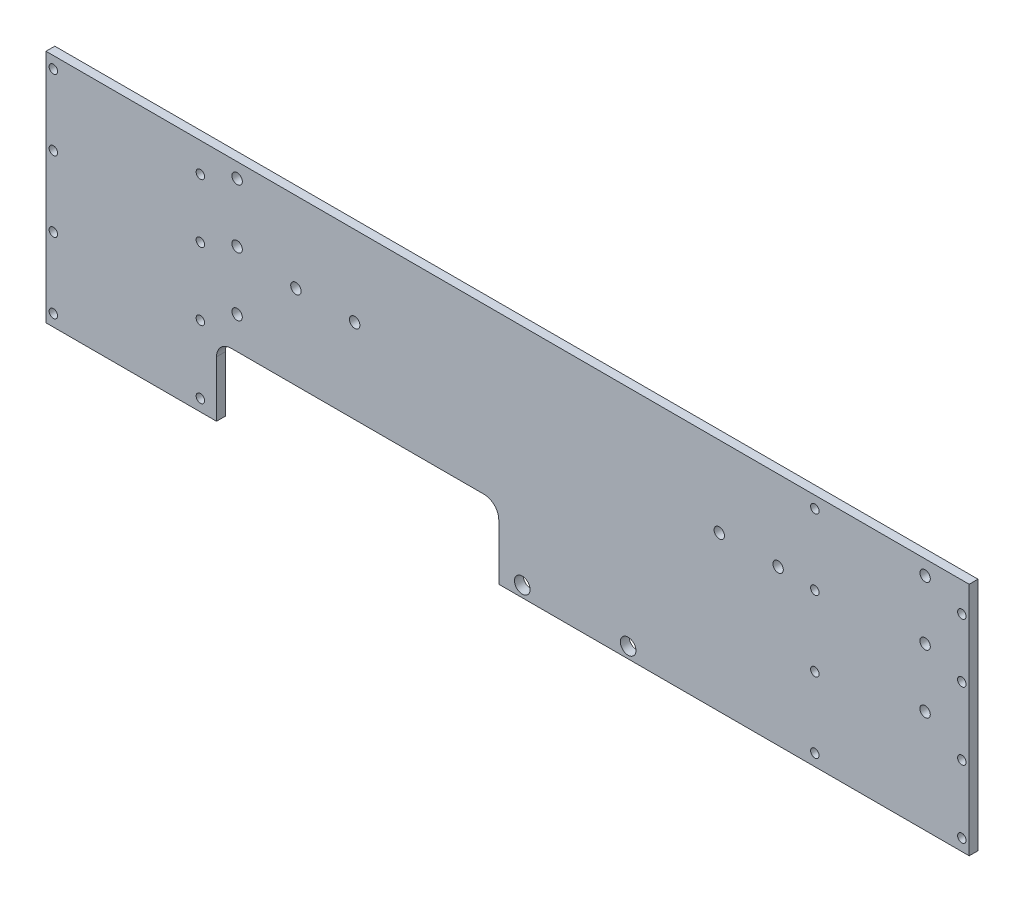
from build123d import *

# Parameters (mm, degrees)
SKETCH1_W               = 398.78
SKETCH1_H               = 101.6
BOSS_EXTRUDE1_DEPTH     = 3.81
SKETCH11_W              = 121.92
SKETCH11_H              = 30.48
CUT_EXTRUDE1_DEPTH      = 206.794869227
F_6_CLEARANCE_HOLE1_D   = 3.6576
F_8_CLEARANCE_HOLE1_D   = 4.4958
LPATTERN1_COUNT         = 2
LPATTERN1_PITCH         = 328.93
FILLET1_R               = 6.35
F_1_4_CLEARANCE_HOLE1_D = 6.7564


with BuildPart() as part:
    # Sketch1 → Boss-Extrude1 (new body)
    with BuildSketch(Plane.XY):
        Rectangle(SKETCH1_W, SKETCH1_H)
    extrude(amount=BOSS_EXTRUDE1_DEPTH)

    # Sketch11 → Cut-Extrude1 (cut, through all)
    with BuildSketch(Plane.XY.offset(3.81)):
        with Locations((-64.77, -35.56)):
            Rectangle(SKETCH11_W, SKETCH11_H)
    extrude(amount=-CUT_EXTRUDE1_DEPTH, mode=Mode.SUBTRACT)

    # #6 Clearance Hole1 (through all)
    with Locations(Plane.XY.offset(3.81)):
        with Locations((132.715, -15.24), (196.215, -16.51), (196.215, 12.7), (196.215, 38.1), (132.715, 45.72), (132.715, 15.24), (132.715, -45.72), (196.215, -45.72)):
            f_6_clearance_hole1 = Hole(F_6_CLEARANCE_HOLE1_D / 2)

    # #8 Clearance Hole1 (through all)
    with Locations(Plane.XY.offset(3.81)):
        with Locations((180.34, 44.45), (180.34, 19.05), (180.34, -6.35), (-116.84, 44.45), (-116.84, 19.05), (-116.84, -6.35), (91.44, 16.064768226), (116.84, 16.064768226), (-91.44, 16.064768226), (-66.04, 16.064768226)):
            Hole(F_8_CLEARANCE_HOLE1_D / 2)

    # LPattern1: #6 Clearance Hole1 ×2
    with Locations(*[(-i * LPATTERN1_PITCH, 0, 0) for i in range(1, LPATTERN1_COUNT)]):
        add(f_6_clearance_hole1, mode=Mode.SUBTRACT)

    # Fillet1
    fillet1_edges = [part.edges().sort_by_distance(p)[0] for p in [
        (-125.73, -20.32, 1.905),
        (-3.81, -20.32, 1.905),
    ]]
    fillet(fillet1_edges, radius=FILLET1_R)

    # 1/4 Clearance Hole1 (through all)
    with Locations(Plane.XY.offset(3.81)):
        with Locations((6.35, -46.0375), (52.07, -46.0375)):
            Hole(F_1_4_CLEARANCE_HOLE1_D / 2)


solid = part.part
